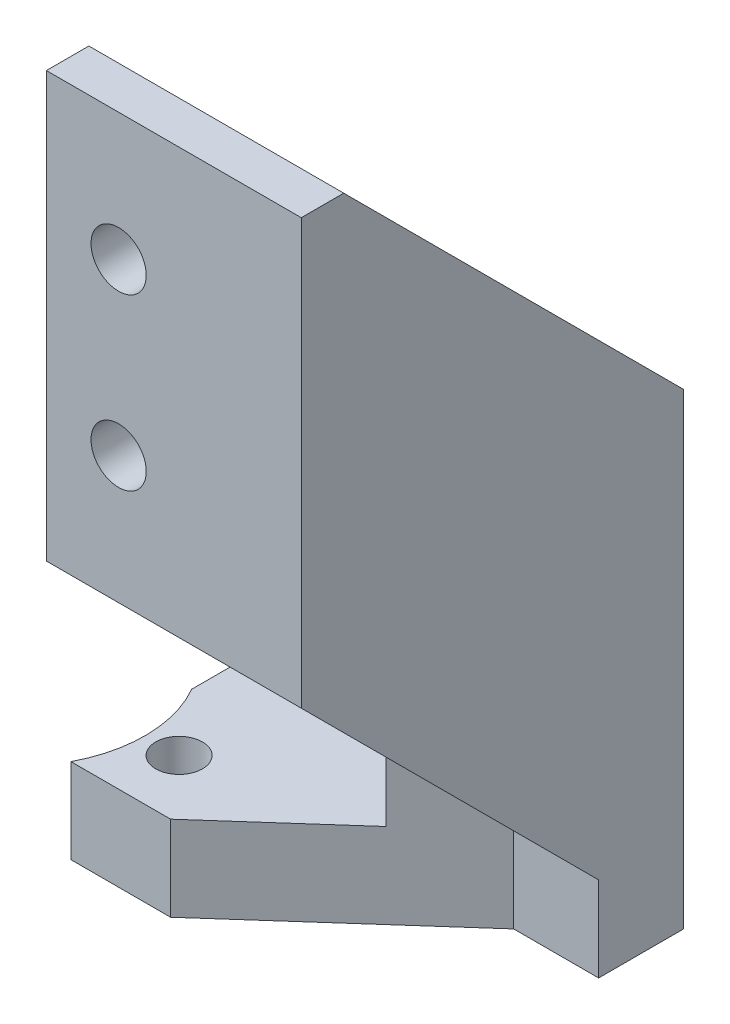
from build123d import *

# Parameters (mm, degrees)
ESQUISSE1_W             = 40
ESQUISSE1_H             = 45
ESQUISSE1_R             = 1.75
BOSS_EXTRU_1_DEPTH      = 10
ESQUISSE2_R             = 4
ENL_V_MAT_EXTRU_2_DEPTH = 5
BOSS_EXTRU_2_DEPTH      = 10
ESQUISSE4_W             = 5
ESQUISSE4_H             = 50
BOSS_EXTRU_3_DEPTH      = 20
ENL_V_MAT_EXTRU_3_REACH = 106.163
ESQUISSE5_R             = 3.25
ESQUISSE7_R             = 2.75
BOSS_EXTRU_4_DEPTH      = 10
ENL_V_MAT_EXTRU_5_REACH = 115.719
ESQUISSE8_R             = 15
CHANFREIN1_SIZE         = 15
ENL_V_MAT_EXTRU_4_REACH = 105.475
CHANFREIN3_SIZE         = 3.5


with BuildPart() as part:
    # Esquisse1 → Boss.-Extru.1 (new body)
    with BuildSketch(Plane.XY):
        with Locations((-20, 22.5)):
            Rectangle(ESQUISSE1_W, ESQUISSE1_H)
        with Locations((-16.5, 32.5)):
            Circle(ESQUISSE1_R, mode=Mode.SUBTRACT)
        with Locations((-36.5, 32.5)):
            Circle(ESQUISSE1_R, mode=Mode.SUBTRACT)
        with Locations((-36.5, 12.5)):
            Circle(ESQUISSE1_R, mode=Mode.SUBTRACT)
        with Locations((-16.5, 12.5)):
            Circle(ESQUISSE1_R, mode=Mode.SUBTRACT)
    extrude(amount=BOSS_EXTRU_1_DEPTH)

    # Esquisse2 → Enlèv. mat.-Extru.2 (cut)
    with BuildSketch(Plane.XY.offset(10)):
        with Locations((-36.5, 32.5)):
            Circle(ESQUISSE2_R)
        with Locations((-16.5, 32.5)):
            Circle(ESQUISSE2_R)
        with Locations((-36.5, 12.5)):
            Circle(ESQUISSE2_R)
        with Locations((-16.5, 12.5)):
            Circle(ESQUISSE2_R)
    extrude(amount=-ENL_V_MAT_EXTRU_2_DEPTH, mode=Mode.SUBTRACT)

    # Esquisse3 → Boss.-Extru.2 (add)
    with BuildSketch(Plane.ZY):
        Polygon((10, 0), (45, 35), (45, 85), (40, 85), (0, 45), (10, 45), align=None)
    extrude(amount=BOSS_EXTRU_2_DEPTH)

    # Esquisse4 → Boss.-Extru.3 (add)
    with BuildSketch(Plane.ZY.offset(10)):
        with Locations((42.5, 60)):
            Rectangle(ESQUISSE4_W, ESQUISSE4_H)
    extrude(amount=BOSS_EXTRU_3_DEPTH)

    # Esquisse5 → Enlèv. mat.-Extru.3 (cut, up to next)
    with BuildSketch(Plane.XY.offset(45), mode=Mode.PRIVATE) as enl_v_mat_extru_3_sk1:
        with Locations((-21.5, 70)):
            Circle(ESQUISSE5_R)
    enl_v_mat_extru_3_tool1 = extrude(enl_v_mat_extru_3_sk1.sketch, amount=-ENL_V_MAT_EXTRU_3_REACH, mode=Mode.PRIVATE) & part.part
    # Esquisse5 → Enlèv. mat.-Extru.3 (cut, up to next)
    with BuildSketch(Plane.XY.offset(45), mode=Mode.PRIVATE) as enl_v_mat_extru_3_sk2:
        with Locations((-21.5, 50)):
            Circle(ESQUISSE5_R)
    enl_v_mat_extru_3_tool2 = extrude(enl_v_mat_extru_3_sk2.sketch, amount=-ENL_V_MAT_EXTRU_3_REACH, mode=Mode.PRIVATE) & part.part
    add(enl_v_mat_extru_3_tool1.solids().sort_by_distance((-21.5, 70, 45))[0], mode=Mode.SUBTRACT)
    add(enl_v_mat_extru_3_tool2.solids().sort_by_distance((-21.5, 50, 45))[0], mode=Mode.SUBTRACT)

    # Esquisse7 → Boss.-Extru.4 (add)
    with BuildSketch(Plane.XZ):
        Polygon((0, 0), (0, 10), (-10, 10), (-31.3834406, 29), (-43.3834406, 29), (-43.3834406, 0), align=None)
        with Locations(Location((-37.3834406, 22, 0), (0, 0, 270))):
            Circle(ESQUISSE7_R, mode=Mode.SUBTRACT)
    extrude(amount=BOSS_EXTRU_4_DEPTH)

    # Esquisse8 → Enlèv. mat.-Extru.5 (cut, up to next)
    with BuildSketch(Plane.XZ.offset(10), mode=Mode.PRIVATE) as enl_v_mat_extru_5_sk1:
        with Locations((-56.3834406, 22)):
            Circle(ESQUISSE8_R)
    enl_v_mat_extru_5_tool1 = extrude(enl_v_mat_extru_5_sk1.sketch, amount=-ENL_V_MAT_EXTRU_5_REACH, mode=Mode.PRIVATE) & part.part
    add(enl_v_mat_extru_5_tool1.solids().sort_by_distance((-56.383441, -10, 22))[0], mode=Mode.SUBTRACT)

    # Chanfrein1
    # the kernel refuses this chamfer: 15 mm, written as the material it adds along each edge
    with BuildSketch(Plane(origin=(-10, 35, 40), x_dir=(0, 0, -1), z_dir=(0, 1, 0))) as chanfrein1_piece_1_section:
        Polygon((CHANFREIN1_SIZE, 0), (0, CHANFREIN1_SIZE), (0, 0), align=None)
    chanfrein1_piece_1 = extrude(amount=88.575244819, mode=Mode.PRIVATE)
    chanfrein1_piece_1 = split(chanfrein1_piece_1, bisect_by=Plane(origin=(-10, 60, 15), z_dir=(0, -0.707106781186543, 0.7071067811865521)), keep=Keep.TOP, mode=Mode.PRIVATE)
    chanfrein1_piece_1 = chanfrein1_piece_1 - Plane(origin=(-21.5, 50, 40), x_dir=(1, 0, 0), z_dir=(0, 0, 1)) * Cylinder(3.25, 238, mode=Mode.PRIVATE)
    chanfrein1_piece_1 = chanfrein1_piece_1 - Plane(origin=(-21.5, 70, 40), x_dir=(1, 0, 0), z_dir=(0, 0, 1)) * Cylinder(3.25, 238, mode=Mode.PRIVATE)
    add(chanfrein1_piece_1)
    with BuildSketch(Plane(origin=(-10, 83.575244819, 10), x_dir=(0, 0, 1), z_dir=(0, -1, 0))) as chanfrein1_piece_2_section:
        Polygon((CHANFREIN1_SIZE, 0), (0, CHANFREIN1_SIZE), (0, 0), align=None)
    chanfrein1_piece_2 = extrude(amount=122.150489639, mode=Mode.PRIVATE)
    chanfrein1_piece_2 = split(chanfrein1_piece_2, bisect_by=Plane(origin=(-10, 69.28762241, 24.28762241), z_dir=(0, -0.707106781186543, 0.7071067811865521)), keep=Keep.TOP, mode=Mode.PRIVATE)
    chanfrein1_piece_2 = split(chanfrein1_piece_2, bisect_by=Plane(origin=(-10, 41.78762241, 51.78762241), z_dir=(0, 0.7071067811865328, -0.7071067811865622)), keep=Keep.TOP, mode=Mode.PRIVATE)
    chanfrein1_piece_2 = chanfrein1_piece_2 - Plane(origin=(-16.5, 12.5, 10), x_dir=(1, 0, 0), z_dir=(0, 0, 1)) * Cylinder(4, 305, mode=Mode.PRIVATE)
    chanfrein1_piece_2 = chanfrein1_piece_2 - Plane(origin=(-16.5, 32.5, 10), x_dir=(1, 0, 0), z_dir=(0, 0, 1)) * Cylinder(4, 305, mode=Mode.PRIVATE)
    chanfrein1_piece_2 = split(chanfrein1_piece_2, bisect_by=Plane(origin=(1.78762241, 71.78762241, 10), z_dir=(0.7071067811865477, -0.7071067811865474, 0)), keep=Keep.TOP, mode=Mode.PRIVATE)
    add(chanfrein1_piece_2)
    with BuildSketch(Plane(origin=(-10, 83.575244819, 10), x_dir=(0, 0, 1), z_dir=(0, -1, 0))) as chanfrein1_piece_3_section:
        Polygon((CHANFREIN1_SIZE, 0), (0, CHANFREIN1_SIZE), (0, 0), align=None)
    chanfrein1_piece_3 = extrude(amount=83.575244819, mode=Mode.PRIVATE)
    chanfrein1_piece_3 = split(chanfrein1_piece_3, bisect_by=Plane(origin=(-10, 41.78762241, 51.78762241), z_dir=(0, -0.7071067811865328, 0.7071067811865622)), keep=Keep.TOP, mode=Mode.PRIVATE)
    chanfrein1_piece_3 = split(chanfrein1_piece_3, bisect_by=Plane(origin=(-10, 83.575244819, 10), z_dir=(-0.6642173069108601, 0, -0.7475395435694919)), keep=Keep.TOP, mode=Mode.PRIVATE)
    add(chanfrein1_piece_3)
    with BuildSketch(Plane(origin=(-10, 45, -38.575244819), x_dir=(-1, 0, 0), z_dir=(0, 0, 1))) as chanfrein1_piece_4_section:
        Polygon((CHANFREIN1_SIZE, 0), (0, -CHANFREIN1_SIZE), (0, 0), align=None)
    chanfrein1_piece_4 = extrude(amount=87.150489639, mode=Mode.PRIVATE)
    chanfrein1_piece_4 = split(chanfrein1_piece_4, bisect_by=Plane(origin=(-10, 25.71237759, -19.28762241), z_dir=(0, -0.707106781186543, 0.7071067811865521)), keep=Keep.TOP, mode=Mode.PRIVATE)
    chanfrein1_piece_4 = split(chanfrein1_piece_4, bisect_by=Plane(origin=(-41.78762241, 45, -6.78762241), z_dir=(0.7071067811865476, 0, -0.7071067811865476)), keep=Keep.TOP, mode=Mode.PRIVATE)
    add(chanfrein1_piece_4)

    # Esquisse6 → Enlèv. mat.-Extru.4 (cut, up to next)
    with BuildSketch(Plane(origin=(0, 0, 40), x_dir=(-1, 0, 0), z_dir=(0, 0, -1)), mode=Mode.PRIVATE) as enl_v_mat_extru_4_sk1:
        with BuildLine():
            Line((13.5, 70), (13.5, 85))
            Line((13.5, 85), (29.5, 85))
            Line((29.5, 85), (29.5, 70))
            ThreePointArc((29.5, 70), (21.5, 62), (13.5, 70))
        make_face()
    enl_v_mat_extru_4_tool1 = extrude(enl_v_mat_extru_4_sk1.sketch, amount=ENL_V_MAT_EXTRU_4_REACH, mode=Mode.PRIVATE) & part.part
    # Esquisse6 → Enlèv. mat.-Extru.4 (cut, up to next)
    with BuildSketch(Plane(origin=(0, 0, 40), x_dir=(-1, 0, 0), z_dir=(0, 0, -1)), mode=Mode.PRIVATE) as enl_v_mat_extru_4_sk2:
        with BuildLine():
            Line((29.5, 50), (29.5, 35))
            Line((29.5, 35), (13.5, 35))
            Line((13.5, 35), (13.5, 50))
            ThreePointArc((13.5, 50), (21.5, 58), (29.5, 50))
        make_face()
    enl_v_mat_extru_4_tool2 = extrude(enl_v_mat_extru_4_sk2.sketch, amount=ENL_V_MAT_EXTRU_4_REACH, mode=Mode.PRIVATE) & part.part
    add(enl_v_mat_extru_4_tool1.solids().sort_by_distance((-21.5, 74.283507, 40))[0], mode=Mode.SUBTRACT)
    add(enl_v_mat_extru_4_tool2.solids().sort_by_distance((-21.5, 45.716493, 40))[0], mode=Mode.SUBTRACT)

    # Chanfrein3
    # the kernel refuses this chamfer: 3.5 mm, written as the material it adds along each edge
    with BuildSketch(Plane(origin=(-10, 35, 15.999109542), x_dir=(0, -1, 0), z_dir=(0, 0, 1))) as chanfrein3_piece_1_section:
        Polygon((CHANFREIN3_SIZE, 0), (0, -CHANFREIN3_SIZE), (0, 0), align=None)
    chanfrein3_piece_1 = extrude(amount=38.001780916, mode=Mode.PRIVATE)
    chanfrein3_piece_1 = split(chanfrein3_piece_1, bisect_by=Plane(origin=(-10, 20.499554771, 30.499554771), z_dir=(0, 0.7071067811865476, -0.7071067811865476)), keep=Keep.TOP, mode=Mode.PRIVATE)
    chanfrein3_piece_1 = split(chanfrein3_piece_1, bisect_by=Plane(origin=(-5.499554771, 35, 20.499554771), z_dir=(0.7071067811865476, 0, 0.7071067811865476)), keep=Keep.TOP, mode=Mode.PRIVATE)
    add(chanfrein3_piece_1)


solid = part.part
